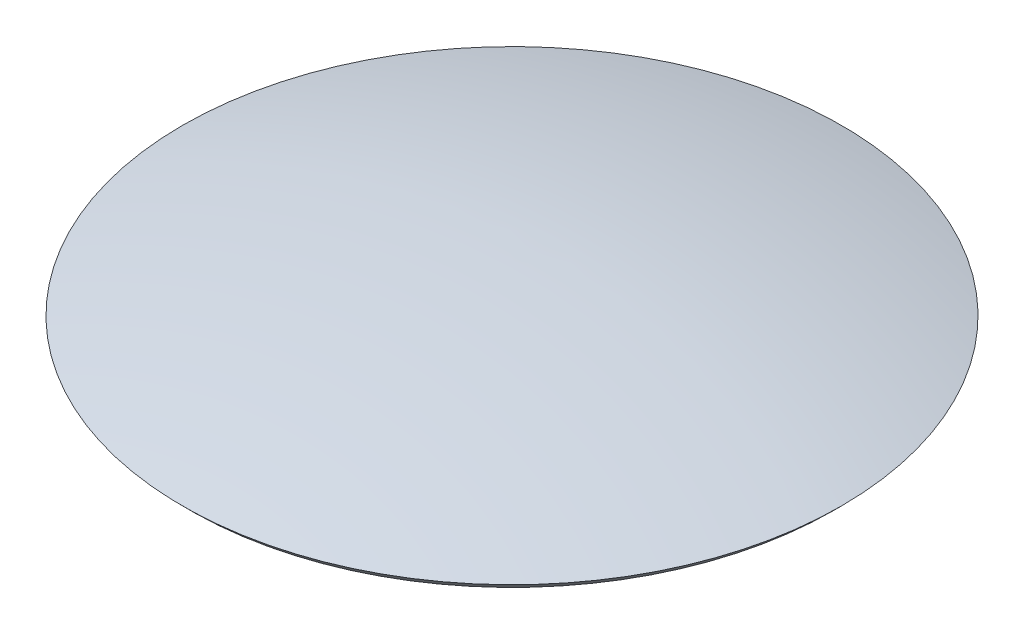
from build123d import *

# Parameters (mm, degrees)
CHAMFER1_SIZE = 1


with BuildPart() as part:
    # Sketch1 → Revolve1 (revolve)
    with BuildSketch(Plane.XY):
        with BuildLine():
            Line((0, 1.5), (0, 0))
            Line((0, 0), (-10, 0))
            ThreePointArc((-10, 0), (-5.055937104, 1.122914027), (0, 1.5))
        make_face()
    revolve(axis=Axis((0, 1.5, 0), (0, -1, 0)))

    # Chamfer1
    # the kernel refuses this chamfer: 1, 0.800391389 mm, written as the material it takes off along each edge
    with BuildSketch(Plane(origin=(0, 0, 0), x_dir=(-1, 0, 0), z_dir=(0, 0, 1))) as chamfer1_piece_1:
        with BuildLine():
            Line((10 - CHAMFER1_SIZE, 0), (9.227215387, -0.227215387))
            ThreePointArc((9.227215387, -0.227215387), (9.623464085, -0.113188655), (10, 0))
            Line((10, 0), (10 - CHAMFER1_SIZE, 0))
        make_face()
    revolve(axis=Axis((0, 0, 0), (0, -1, 0)), mode=Mode.SUBTRACT)


solid = part.part
